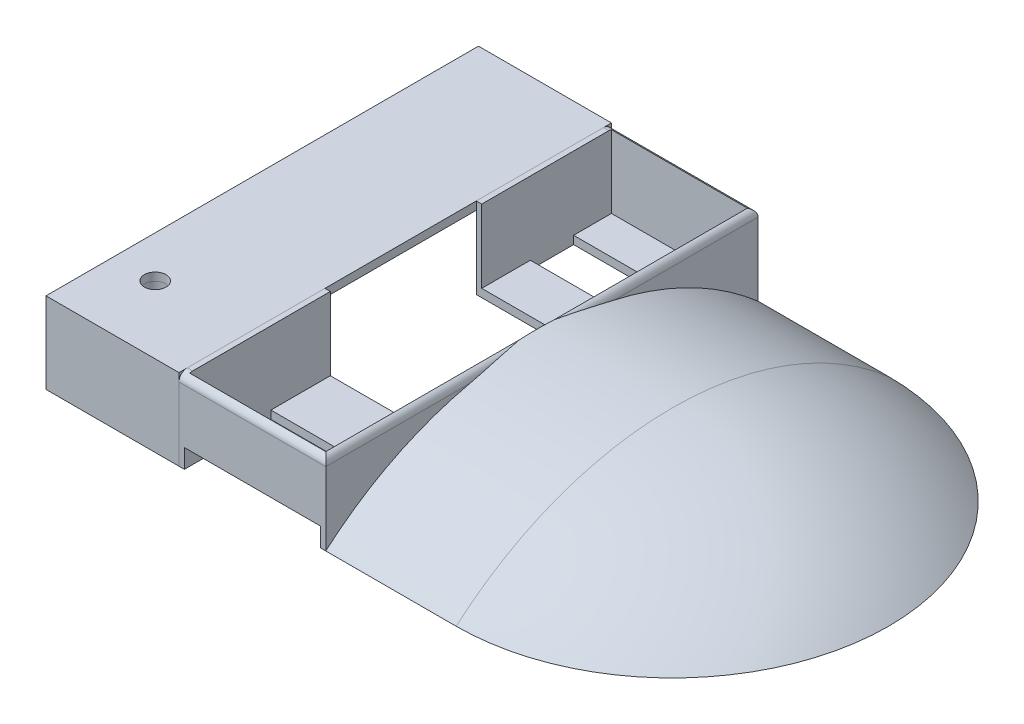
from build123d import *

# Parameters (mm, degrees)
SKETCH1_W                  = 51.75
SKETCH1_H                  = 80
BOSS_EXTRUDE1_DEPTH        = 15
SHELL3_T                   = -1.5
CUT_EXTRUDE2_DEPTH         = 1.5
SKETCH6_W                  = 13.65
SKETCH6_H                  = 7.3
CUT_EXTRUDE3_DEPTH         = 1.5
SKETCH11_R                 = 2
BOSS_EXTRUDE10_DEPTH       = 11
SKETCH11_3_R               = 2
CUT_EXTRUDE10_DEPTH        = 1.5
SHELL9_T                   = 1
SKETCH47_W                 = 27.15
SKETCH47_H                 = 15
CUT_EXTRUDE15_DEPTH        = 86.407936546
SKETCH47_2_W               = 27.15
SKETCH47_2_H               = 15
BOSS_EXTRUDE12_DEPTH       = 80
SHELL15_T                  = -1
SHELL15_THICKNESS_2_FACE_W = 78
SHELL15_THICKNESS_2_FACE_H = 25.15
SHELL15_THICKNESS_2_DEPTH  = 0.5
SKETCH52_W                 = 25.15
SKETCH52_H                 = 3.5
CUT_EXTRUDE21_DEPTH        = 1
SKETCH54_W                 = 28
SKETCH54_H                 = 15
CUT_EXTRUDE22_DEPTH        = 1
SKETCH55_W                 = 25.15
SKETCH55_H                 = 15
SKETCH55_W_2               = 26.15
SKETCH55_H_2               = 28
SKETCH55_H_3               = 8
CUT_EXTRUDE23_DEPTH        = 1.5
BOSS_EXTRUDE13_DEPTH       = 24.13
REVOLVE5_ANGLE             = 180
FILLET1_R                  = 1.5


with BuildPart() as part:
    # Sketch1 → Boss-Extrude1 (new body)
    with BuildSketch(Plane(origin=(0, 0, 0), x_dir=(1, 0, 0), z_dir=(0, 1, 0))):
        Rectangle(SKETCH1_W, SKETCH1_H)
    extrude(amount=BOSS_EXTRUDE1_DEPTH)

    # Shell3
    shell3_openings = [part.faces().sort_by_distance(p)[0] for p in [
        (0, 0, 0),
    ]]
    offset(amount=SHELL3_T, openings=shell3_openings, kind=Kind.INTERSECTION)

    # Sketch4 → Cut-Extrude2 (cut)
    with BuildSketch(Plane.ZY.offset(25.875)):
        with BuildLine():
            Line((-34.38, 3.4), (-28.48, 3.4))
            ThreePointArc((-28.48, 3.4), (-26.68, 1.6), (-28.48, -0.2))
            Line((-28.48, -0.2), (-34.38, -0.2))
            ThreePointArc((-34.38, -0.2), (-36.18, 1.6), (-34.38, 3.4))
        make_face()
    extrude(amount=-CUT_EXTRUDE2_DEPTH, mode=Mode.SUBTRACT)

    # Sketch6 → Cut-Extrude3 (cut)
    with BuildSketch(Plane.ZY.offset(25.875)):
        with Locations((-17.575, 3.65)):
            Rectangle(SKETCH6_W, SKETCH6_H)
    extrude(amount=-CUT_EXTRUDE3_DEPTH, mode=Mode.SUBTRACT)

    # Sketch11 → Boss-Extrude10 (add)
    with BuildSketch(Plane(origin=(0, 15, 0), x_dir=(1, 0, 0), z_dir=(0, 1, 0))):
        with Locations(Location((-18.175, -27.5, 0), (0, 0, 270))):
            Circle(SKETCH11_R)
    extrude(amount=-BOSS_EXTRUDE10_DEPTH)

    # Sketch11<3> → Cut-Extrude10 (cut)
    with BuildSketch(Plane(origin=(0, 15, 0), x_dir=(1, 0, 0), z_dir=(0, 1, 0))):
        with Locations(Location((-18.175, -27.5, 0), (0, 0, 270))):
            Circle(SKETCH11_3_R)
    extrude(amount=-CUT_EXTRUDE10_DEPTH, mode=Mode.SUBTRACT)


with BuildPart() as cut_extrude10_piece_1:
    # of the separate pieces the step leaves, piece 1, a body of its own (cut_extrude10_pieces)
    add(part.part.solids().sort_by_distance((-25.875, 0, 40))[0])

    # Sketch47 → Cut-Extrude15 (cut, through all)
    with BuildSketch(Plane.XY.offset(40)):
        with Locations((12.3, 7.5)):
            Rectangle(SKETCH47_W, SKETCH47_H)
    extrude(amount=-CUT_EXTRUDE15_DEPTH, mode=Mode.SUBTRACT)


with BuildPart() as cut_extrude10_piece_2:
    # of the separate pieces the step leaves, piece 2, a body of its own (cut_extrude10_pieces)
    add(part.part.solids().sort_by_distance((-18.175, 4, 29.5))[0])

    # Shell9
    shell9_openings = [cut_extrude10_piece_2.faces().sort_by_distance(p)[0] for p in [
        (-18.175, 4, 27.5),
        (-18.175, 13.5, 27.5),
    ]]
    offset(amount=SHELL9_T, openings=shell9_openings, kind=Kind.INTERSECTION)


with BuildPart() as body_3:
    # Sketch47<2> → Boss-Extrude12 (new body)
    with BuildSketch(Plane.XY.offset(40)):
        with Locations((12.3, 7.5)):
            Rectangle(SKETCH47_2_W, SKETCH47_2_H)
    extrude(amount=-BOSS_EXTRUDE12_DEPTH)

    # Shell15
    shell15_openings = [body_3.faces().sort_by_distance(p)[0] for p in [
        (12.3, 15, 0),
    ]]
    offset(amount=SHELL15_T, openings=shell15_openings, kind=Kind.INTERSECTION)

    # Shell15 thickness 2 face (on inner face of the shell) → Shell15 thickness 2 (add)
    with BuildSketch(Plane(origin=(12.3, 1, 0), x_dir=(0, 0, -1), z_dir=(0, -1, 0))):
        Rectangle(SHELL15_THICKNESS_2_FACE_W, SHELL15_THICKNESS_2_FACE_H)
    extrude(amount=-SHELL15_THICKNESS_2_DEPTH)

    # Sketch52 → Cut-Extrude21 (cut)
    with BuildSketch(Plane(origin=(0, 0, 39), x_dir=(-1, 0, 0), z_dir=(0, 0, -1))):
        with Locations((-12.3, 1.75)):
            Rectangle(SKETCH52_W, SKETCH52_H)
    extrude(amount=-CUT_EXTRUDE21_DEPTH, mode=Mode.SUBTRACT)

    # Sketch54 → Cut-Extrude22 (cut)
    with BuildSketch(Plane(origin=(-0.275, 0, 0), x_dir=(0, 0, -1), z_dir=(1, 0, 0))):
        with Locations((1, 7.5)):
            Rectangle(SKETCH54_W, SKETCH54_H)
    extrude(amount=-CUT_EXTRUDE22_DEPTH, mode=Mode.SUBTRACT)

    # Sketch55 → Cut-Extrude23 (cut)
    with BuildSketch(Plane(origin=(0, 1.5, 0), x_dir=(1, 0, 0), z_dir=(0, 1, 0))):
        with Locations((12.3, -31.5)):
            Rectangle(SKETCH55_W, SKETCH55_H)
        with Locations((11.8, 1)):
            Rectangle(SKETCH55_W_2, SKETCH55_H_2)
        with Locations((12.3, 28)):
            Rectangle(SKETCH55_W, SKETCH55_H_3)
    extrude(amount=-CUT_EXTRUDE23_DEPTH, mode=Mode.SUBTRACT)

    # Sketch63 → Boss-Extrude13 (add)
    with BuildSketch(Plane(origin=(50, 0, 0), x_dir=(0, 0, -1), z_dir=(1, 0, 0))):
        with BuildLine():
            Line((-40, 0), (40, 0))
            ThreePointArc((40, 0), (0, 15.000821957), (-40, 0))
        make_face()
    extrude(amount=-BOSS_EXTRUDE13_DEPTH)

    # Sketch69 → Revolve5 (revolve)
    with BuildSketch(Plane(origin=(50, 0, 0), x_dir=(0, 0, -1), z_dir=(1, 0, 0))):
        with BuildLine():
            Line((0, 15.000821957), (0, 0))
            Line((0, 0), (-40, 0))
            ThreePointArc((-40, 0), (-21.360153671, 11.127288692), (0, 15.000821957))
        make_face()
    revolve(axis=Axis((50, 15.000821957, 0), (0, 1, 0)), revolution_arc=REVOLVE5_ANGLE)

    # Fillet1
    # the kernel refuses this fillet: 1.5 mm, written as the material it takes off along each edge
    with BuildSketch(Plane(origin=(25.875, 15, 43.75), x_dir=(0, -1, 0), z_dir=(0, 0, -1))) as fillet1_piece_1_section:
        with BuildLine():
            CenterArc((FILLET1_R, FILLET1_R), FILLET1_R, 180, 90)
            Line((0, FILLET1_R), (0, 0))
            Line((0, 0), (FILLET1_R, 0))
        make_face()
    fillet1_piece_1 = extrude(amount=47.183772234, mode=Mode.PRIVATE)
    fillet1_piece_1 = fillet1_piece_1 - Plane(origin=(25.872528752, -45.83, 0), x_dir=(0, 0.753400965585748, -0.6575613926124789), z_dir=(1, 0, 0)) * Cylinder(60.830821957, 101, mode=Mode.PRIVATE)
    add(fillet1_piece_1, mode=Mode.SUBTRACT)
    with BuildSketch(Plane(origin=(29.625, 15, -40), x_dir=(0, -1, 0), z_dir=(-1, 0, 0))) as fillet1_piece_2:
        with BuildLine():
            CenterArc((FILLET1_R, FILLET1_R), FILLET1_R, 180, 90)
            Line((0, FILLET1_R), (0, 0))
            Line((0, 0), (FILLET1_R, 0))
        make_face()
    extrude(amount=34.65, mode=Mode.SUBTRACT)
    with BuildSketch(Plane(origin=(29.625, 15, 40), x_dir=(0, -1, 0), z_dir=(-1, 0, 0))) as fillet1_piece_3:
        with BuildLine():
            CenterArc((FILLET1_R, -FILLET1_R), FILLET1_R, 90, 90)
            Line((0, -FILLET1_R), (0, 0))
            Line((0, 0), (FILLET1_R, 0))
        make_face()
    extrude(amount=34.65, mode=Mode.SUBTRACT)
    with BuildSketch(Plane(origin=(25.875, 15, 3.433772234), x_dir=(-1, 0, 0), z_dir=(0, 0, -1))) as fillet1_piece_4_section:
        with BuildLine():
            CenterArc((FILLET1_R, -FILLET1_R), FILLET1_R, 90, 90)
            Line((0, -FILLET1_R), (0, 0))
            Line((0, 0), (FILLET1_R, 0))
        make_face()
    fillet1_piece_4 = extrude(amount=47.183772234, mode=Mode.PRIVATE)
    fillet1_piece_4 = fillet1_piece_4 - Plane(origin=(25.372542367, -45.83, 0), x_dir=(0, 0.753400965585748, -0.6575613926124789), z_dir=(1, 0, 0)) * Cylinder(60.830821957, 101, mode=Mode.PRIVATE)
    add(fillet1_piece_4, mode=Mode.SUBTRACT)


solid = Compound([cut_extrude10_piece_1.part, cut_extrude10_piece_2.part, body_3.part])
